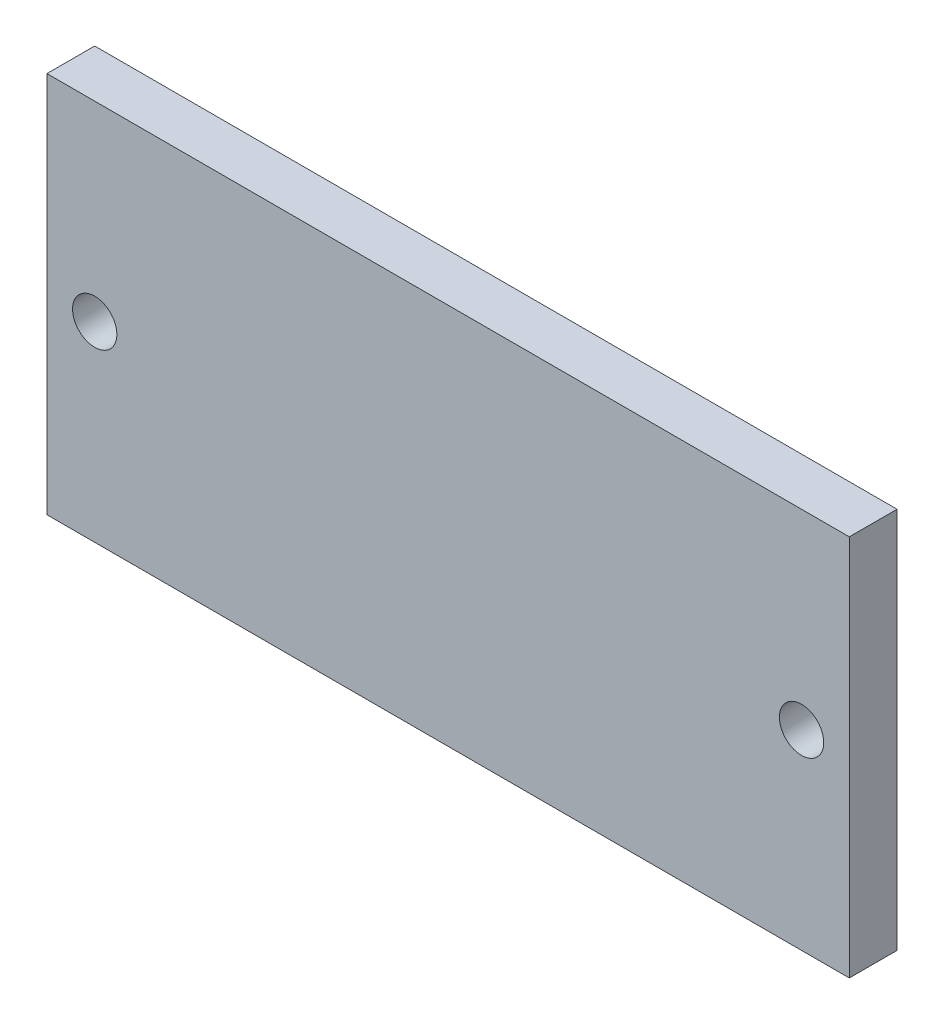
from build123d import *

# Parameters (mm, degrees)
SKETCH1_W           = 53.34
SKETCH1_H           = 25.4
SKETCH1_R           = 1.4732
BOSS_EXTRUDE1_DEPTH = 3.175


with BuildPart() as part:
    # Sketch1 → Boss-Extrude1 (new body)
    with BuildSketch(Plane.XY):
        Rectangle(SKETCH1_W, SKETCH1_H)
        with Locations((-23.495, 0)):
            Circle(SKETCH1_R, mode=Mode.SUBTRACT)
        with Locations((23.495, 0)):
            Circle(SKETCH1_R, mode=Mode.SUBTRACT)
    extrude(amount=BOSS_EXTRUDE1_DEPTH)


solid = part.part
